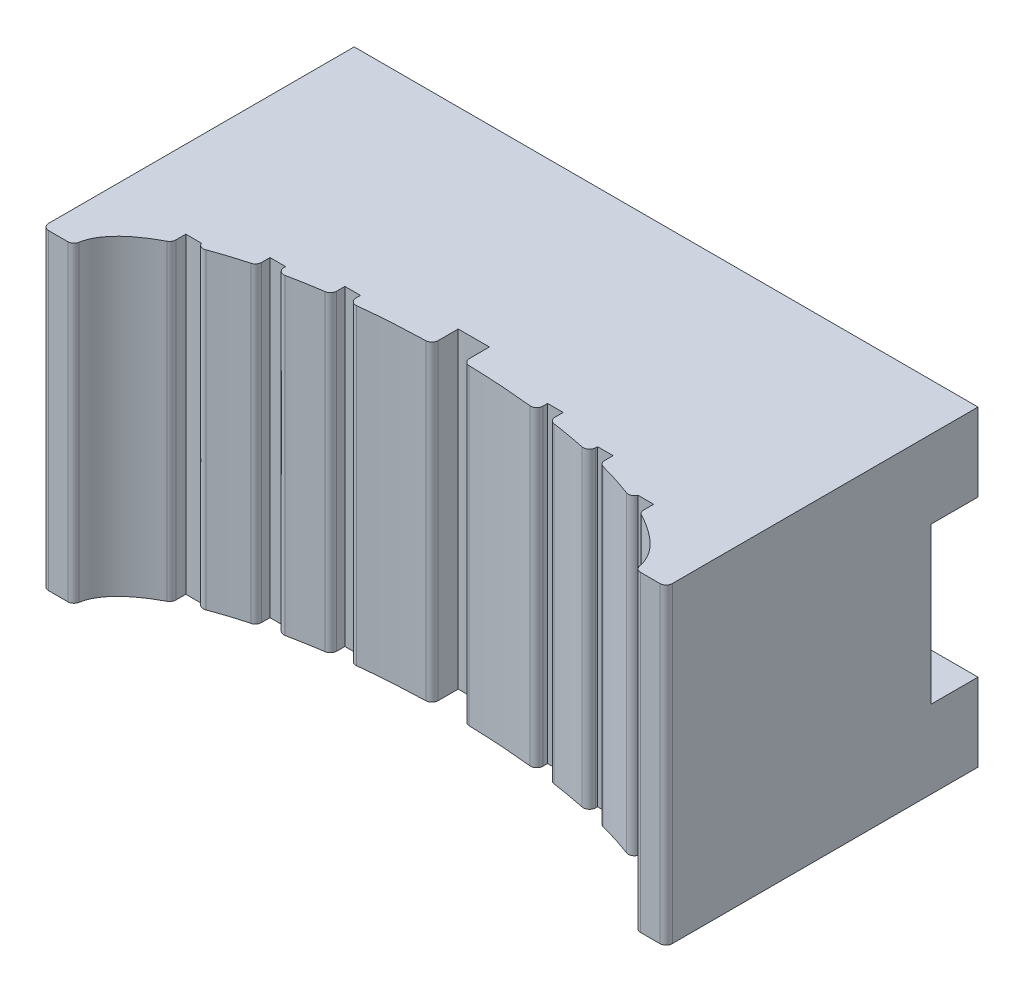
from build123d import *

# Parameters (mm, degrees)
SKIZZE1_W                       = 20
SKIZZE1_H                       = 10
AUFSATZ_LINEAR_AUSTRAGEN1_DEPTH = 10
SKIZZE3_W                       = 4.1
SKIZZE3_H                       = 1.9
SCHNITT_LINEAR_AUSTRAGEN2_DEPTH = 5
SKIZZE9_RX                      = 9
SKIZZE9_RY                      = 3
SCHNITT_LINEAR_AUSTRAGEN3_DEPTH = 10
SKIZZE10_W                      = 6.95
SKIZZE10_H                      = 5
SCHNITT_LINEAR_AUSTRAGEN4_DEPTH = 1.5
SKIZZE11_W                      = 7
SKIZZE11_H                      = 5
SCHNITT_LINEAR_AUSTRAGEN5_DEPTH = 1.5
SKIZZE13_W                      = 1
SKIZZE13_H                      = 1
SCHNITT_LINEAR_AUSTRAGEN7_DEPTH = 10
SKIZZE14_W                      = 0.5
SKIZZE14_H                      = 0.5
SCHNITT_LINEAR_AUSTRAGEN8_DEPTH = 10
VERRUNDUNG2_R                   = 0.2
VERRUNDUNG3_R                   = 0.2
VERRUNDUNG4_R                   = 0.2
VERRUNDUNG5_R                   = 0.2
VERRUNDUNG6_R                   = 0.2


with BuildPart() as part:
    # Skizze1 → Aufsatz-Linear austragen1 (new body)
    with BuildSketch(Plane.XY):
        with Locations((-10, 2.346944746)):
            Rectangle(SKIZZE1_W, SKIZZE1_H)
    extrude(amount=AUFSATZ_LINEAR_AUSTRAGEN1_DEPTH)

    # Skizze3 → Schnitt-Linear austragen2 (cut)
    with BuildSketch(Plane(origin=(0, 0, 0), x_dir=(-1, 0, 0), z_dir=(0, 0, -1))):
        with Locations((10, 2.346944746)):
            Rectangle(SKIZZE3_W, SKIZZE3_H)
    extrude(amount=-SCHNITT_LINEAR_AUSTRAGEN2_DEPTH, mode=Mode.SUBTRACT)

    # Skizze9 → Schnitt-Linear austragen3 (cut)
    with BuildSketch(Plane(origin=(0, 7.346944746, 0), x_dir=(1, 0, 0), z_dir=(0, 1, 0))):
        with Locations((-10, -10)):
            Ellipse(SKIZZE9_RX, SKIZZE9_RY)
    extrude(amount=-SCHNITT_LINEAR_AUSTRAGEN3_DEPTH, mode=Mode.SUBTRACT)

    # Skizze10 → Schnitt-Linear austragen4 (cut)
    with BuildSketch(Plane(origin=(0, 0, 0), x_dir=(-1, 0, 0), z_dir=(0, 0, -1))):
        with Locations((16.525, 2.021356222)):
            Rectangle(SKIZZE10_W, SKIZZE10_H)
    extrude(amount=-SCHNITT_LINEAR_AUSTRAGEN4_DEPTH, mode=Mode.SUBTRACT)

    # Skizze11 → Schnitt-Linear austragen5 (cut)
    with BuildSketch(Plane(origin=(0, 0, 0), x_dir=(-1, 0, 0), z_dir=(0, 0, -1))):
        with Locations((3.5, 2.346944746)):
            Rectangle(SKIZZE11_W, SKIZZE11_H)
    extrude(amount=-SCHNITT_LINEAR_AUSTRAGEN5_DEPTH, mode=Mode.SUBTRACT)

    # Skizze13 → Schnitt-Linear austragen7 (cut)
    with BuildSketch(Plane.XZ.offset(2.653055254)):
        with Locations((-10, 6.665824705)):
            Rectangle(SKIZZE13_W, SKIZZE13_H)
    extrude(amount=-SCHNITT_LINEAR_AUSTRAGEN7_DEPTH, mode=Mode.SUBTRACT)

    # Skizze14 → Schnitt-Linear austragen8 (cut)
    with BuildSketch(Plane.XZ.offset(2.653055254)):
        with Locations((-15.25, 7.45)):
            Rectangle(SKIZZE14_W, SKIZZE14_H)
        with Locations((-4.75, 7.45)):
            Rectangle(SKIZZE14_W, SKIZZE14_H)
        with Locations((-13.25, 7.05)):
            Rectangle(SKIZZE14_W, SKIZZE14_H)
        with Locations((-2.75, 8.15)):
            Rectangle(SKIZZE14_W, SKIZZE14_H)
        with Locations((-17.25, 8.15)):
            Rectangle(SKIZZE14_W, SKIZZE14_H)
        with Locations((-6.75, 7.05)):
            Rectangle(SKIZZE14_W, SKIZZE14_H)
    extrude(amount=-SCHNITT_LINEAR_AUSTRAGEN8_DEPTH, mode=Mode.SUBTRACT)

    # Verrundung2
    verrundung2_edges = [part.edges().sort_by_distance(p)[0] for p in [
        (-13.5, 2.346944746, 7.236146008),
        (-15.5, 2.346944746, 7.625365525),
        (-17.5, 2.346944746, 8.341687605),
        (-19, 2.346944746, 10),
    ]]
    fillet(verrundung2_edges, radius=VERRUNDUNG2_R)

    # Verrundung3
    # the kernel refuses this fillet: 0.2 mm, written as the material it takes off along each edge
    with BuildSketch(Plane(origin=(-17, -3.342182333, 8.114381917), x_dir=(0.9302782404562213, 0, -0.3668547332850931), z_dir=(0, 1, 0))) as verrundung3_piece_1:
        with BuildLine():
            CenterArc((0.278646285, 0.199977567), VERRUNDUNG3_R, 180.155482176, 88.986351642)
            Line((0.078647021, 0.199434832), (0.074647036, 0.199423978))
            ThreePointArc((0.074647036, 0.199423978), (0.035602397, 0.101184835), (-0.003721113, 0.001467419))
            Line((-0.003721113, 0.001467419), (6.2365e-05, -0.003999514))
            ThreePointArc((6.2365e-05, -0.003999514), (0.137824964, -0.002947258), (0.275590922, -0.003999551))
            Line((0.275590922, -0.003999551), (0.275650831, 0))
        make_face()
    extrude(amount=11.378254157, mode=Mode.SUBTRACT)
    with BuildSketch(Plane(origin=(-15, -3.272043648, 7.505561742), x_dir=(0.9776339897126725, 0, -0.2103135329893973), z_dir=(0, 1, 0))) as verrundung3_piece_2:
        with BuildLine():
            CenterArc((0.247599452, 0.199994931), VERRUNDUNG3_R, 167.859273294, 101.732777732)
            Line((0.052072654, 0.242057637), (0.048162118, 0.242898891))
            Line((0.048162118, 0.242898891), (-0.003910536, 0.000841254))
            Line((-0.003910536, 0.000841254), (2.8981e-05, -0.003999895))
            ThreePointArc((2.8981e-05, -0.003999895), (0.123087615, -0.00355801), (0.246146974, -0.003999899))
            Line((0.246146974, -0.003999899), (0.246175454, 0))
        make_face()
    extrude(amount=11.237976787, mode=Mode.SUBTRACT)
    with BuildSketch(Plane(origin=(-13, -3.212731809, 7.171572875), x_dir=(0, 0, -1), z_dir=(0, 1, 0))) as verrundung3_piece_3:
        with BuildLine():
            CenterArc((0.223870622, -0.2), VERRUNDUNG3_R, 90, 96.174915405)
            Line((0.025030991, -0.221512819), (0.021054199, -0.221943076))
            ThreePointArc((0.021054199, -0.221943076), (0.008804856, -0.111175678), (-0.003972508, -0.000468165))
            Line((-0.003972508, -0.000468165), (0, 0.004))
            Line((0, 0.004), (0.223870622, 0.004))
            Line((0.223870622, 0.004), (0.223870622, 0))
        make_face()
    extrude(amount=11.119353109, mode=Mode.SUBTRACT)

    # Verrundung4
    # the kernel refuses this fillet: 0.2 mm, written as the material it takes off along each edge
    with BuildSketch(Plane(origin=(-1, 7.805203231, 10), x_dir=(1, 0, 0), z_dir=(0, -1, 0))) as verrundung4_piece_1:
        with BuildLine():
            CenterArc((0.183303394, -0.2), VERRUNDUNG4_R, 90, 80.504337422)
            Line((-0.013956225, -0.167005412), (-0.017901417, -0.16634552))
            ThreePointArc((-0.017901417, -0.16634552), (-0.007497365, -0.083459179), (-0.004, 0))
            Line((-0.004, 0), (0, 0.004))
            Line((0, 0.004), (0.183303394, 0.004))
            Line((0.183303394, 0.004), (0.183303394, 0))
        make_face()
    extrude(amount=10.91651697, mode=Mode.SUBTRACT)
    with BuildSketch(Plane(origin=(-7, -3.212731809, 7.171572875), x_dir=(0, 0, -1), z_dir=(0, 1, 0))) as verrundung4_piece_2:
        with BuildLine():
            CenterArc((0.223870622, 0.2), VERRUNDUNG4_R, 173.825084595, 96.174915405)
            Line((0.025030991, 0.221512819), (0.021054199, 0.221943076))
            ThreePointArc((0.021054199, 0.221943076), (0.008804856, 0.111175678), (-0.003972508, 0.000468165))
            Line((-0.003972508, 0.000468165), (0, -0.004))
            Line((0, -0.004), (0.223870622, -0.004))
            Line((0.223870622, -0.004), (0.223870622, 0))
        make_face()
    extrude(amount=11.119353109, mode=Mode.SUBTRACT)
    with BuildSketch(Plane(origin=(-3, -3.342182333, 8.114381917), x_dir=(0, 0, -1), z_dir=(0, 1, 0))) as verrundung4_piece_3:
        with BuildLine():
            CenterArc((0.288257487, 0.185855858), VERRUNDUNG4_R, 159.336395365, 88.986351642)
            Line((0.101123812, 0.25643197), (0.097381139, 0.257843493))
            ThreePointArc((0.097381139, 0.257843493), (0.04781997, 0.12929678), (-0.003697782, 0.001525257))
            Line((-0.003697782, 0.001525257), (0, -0.004))
            ThreePointArc((0, -0.004), (0.107190958, -0.004), (0.212904405, -0.003717117))
            Line((0.212904405, -0.003717117), (0.214381917, 0))
        make_face()
    extrude(amount=11.378254157, mode=Mode.SUBTRACT)
    with BuildSketch(Plane(origin=(-5, -3.272043648, 7.505561742), x_dir=(0, 0, -1), z_dir=(0, 1, 0))) as verrundung4_piece_4:
        with BuildLine():
            CenterArc((0.247595357, 0.2), VERRUNDUNG4_R, 168.267222268, 101.732777732)
            Line((0.051774029, 0.240669491), (0.047857603, 0.241482881))
            ThreePointArc((0.047857603, 0.241482881), (0.02240856, 0.121082934), (-0.003904338, 0.000869565))
            Line((-0.003904338, 0.000869565), (0, -0.004))
            Line((0, -0.004), (0.247595357, -0.004))
            Line((0.247595357, -0.004), (0.247595357, 0))
        make_face()
    extrude(amount=11.237976787, mode=Mode.SUBTRACT)
    with BuildSketch(Plane(origin=(-6.5, -3.085874245, 7.236146008), x_dir=(0.9896812974841964, 0, 0.1432861801081929), z_dir=(0, 1, 0))) as verrundung4_piece_5:
        with BuildLine():
            CenterArc((0.173129468, 0.19999838), VERRUNDUNG4_R, 188.238048246, 81.531348944)
            Line((-0.024806792, 0.171341144), (-0.028765517, 0.170767999))
            Line((-0.028765517, 0.170767999), (-0.003958725, -0.000573145))
            Line((-0.003958725, -0.000573145), (1.5974e-05, -0.003999968))
            ThreePointArc((1.5974e-05, -0.003999968), (0.086162287, -0.00382729), (0.172308415, -0.003999968))
            Line((0.172308415, -0.003999968), (0.172324514, 0))
        make_face()
    extrude(amount=10.865637981, mode=Mode.SUBTRACT)
    with BuildSketch(Plane(origin=(-4.5, -3.03856184, 7.625365525), x_dir=(0.9671190047653414, 0, 0.2543242627467847), z_dir=(0, 1, 0))) as verrundung4_piece_6:
        with BuildLine():
            CenterArc((0.15420633, 0.199997151), VERRUNDUNG4_R, 194.733548244, 74.960608015)
            Line((-0.039217471, 0.149132298), (-0.043085947, 0.148115001))
            Line((-0.043085947, 0.148115001), (-0.003868476, -0.001017297))
            Line((-0.003868476, -0.001017297), (2.106e-05, -0.003999945))
            ThreePointArc((2.106e-05, -0.003999945), (0.076569439, -0.003797048), (0.153117387, -0.003999943))
            Line((0.153117387, -0.003999943), (0.153138739, 0))
        make_face()
    extrude(amount=10.771013171, mode=Mode.SUBTRACT)
    with BuildSketch(Plane(origin=(-2.5, -2.958042767, 8.341687605), x_dir=(0.8891677006710952, 0, 0.45758146824721596), z_dir=(0, 1, 0))) as verrundung4_piece_7:
        with BuildLine():
            CenterArc((0.122010887, 0.199990312), VERRUNDUNG4_R, 207.231153848, 62.204893345)
            Line((-0.055822654, 0.108474018), (-0.059379324, 0.106643692))
            Line((-0.059379324, 0.106643692), (-0.003556671, -0.001830326))
            Line((-0.003556671, -0.001830326), (3.845e-05, -0.003999815))
            ThreePointArc((3.845e-05, -0.003999815), (0.060021389, -0.003708116), (0.120002981, -0.003999806))
            Line((0.120002981, -0.003999806), (0.120042352, 0))
        make_face()
    extrude(amount=10.609975026, mode=Mode.SUBTRACT)

    # Verrundung5
    verrundung5_edges = [part.edges().sort_by_distance(p)[0] for p in [
        (-9.5, 2.346944746, 7.004633207),
        (-10.5, 2.346944746, 7.004633207),
    ]]
    fillet(verrundung5_edges, radius=VERRUNDUNG5_R)

    # Verrundung6
    verrundung6_edges = [part.edges().sort_by_distance(p)[0] for p in [
        (-20, 2.346944746, 10),
        (0, 2.346944746, 10),
    ]]
    fillet(verrundung6_edges, radius=VERRUNDUNG6_R)


solid = part.part
